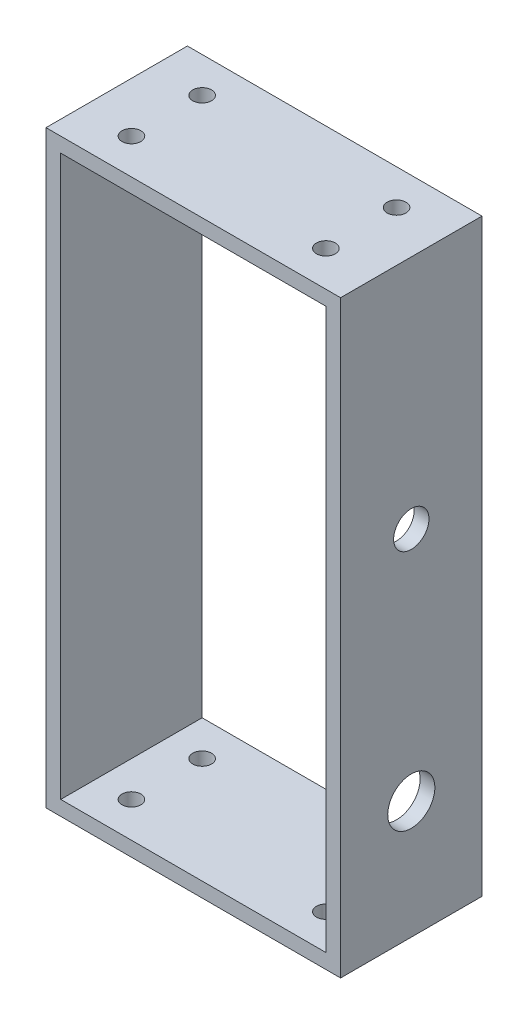
from build123d import *

# Parameters (mm, degrees)
SKETCH_1_W                      = 50
SKETCH_1_H                      = 100
SKETCH_1_W_2                    = 45
SKETCH_1_H_2                    = 95
EXTRUDE_1_DEPTH                 = 24
CUT_EXTRUDE_2_DEPTH             = 106.834776893
CUT_EXTRUDE_2_DEPTH_BACK        = 106.834776893
SKETCH_3_R                      = 1.6
CUT_EXTRUDE_3_REACH             = 76.673
SKETCH_4_R                      = 3
SKETCH_4_R_2                    = 4
CUT_EXTRUDE_3_DIRECTION_2_DEPTH = 75.67261881


with BuildPart() as part:
    # ｽｹｯﾁ1 → ﾎﾞｽ - 押し出し1 (new body)
    with BuildSketch(Plane.XY):
        Rectangle(SKETCH_1_W, SKETCH_1_H)
        Rectangle(SKETCH_1_W_2, SKETCH_1_H_2, mode=Mode.SUBTRACT)
    extrude(amount=EXTRUDE_1_DEPTH)

    # ｽｹｯﾁ3 → ｶｯﾄ - 押し出し2 (cut, two sides: drawn at the far end of the back side and taken through both)
    with BuildSketch(Plane(origin=(0, 50, 0), x_dir=(1, 0, 0), z_dir=(0, 1, 0)).offset(-CUT_EXTRUDE_2_DEPTH_BACK)):
        with Locations(Location((-16.5, -6, 0), (0, 0, 90))):
            Circle(SKETCH_3_R)
        with Locations(Location((16.5, -6, 0), (0, 0, 90))):
            Circle(SKETCH_3_R)
        with Locations(Location((16.5, -18, 0), (0, 0, 90))):
            Circle(SKETCH_3_R)
        with Locations(Location((-16.5, -18, 0), (0, 0, 90))):
            Circle(SKETCH_3_R)
    extrude(amount=CUT_EXTRUDE_2_DEPTH + CUT_EXTRUDE_2_DEPTH_BACK, mode=Mode.SUBTRACT)

    # ｽｹｯﾁ4 → ｶｯﾄ - 押し出し3 (cut, up to next)
    with BuildSketch(Plane(origin=(25, 0, 0), x_dir=(0, 0, -1), z_dir=(1, 0, 0)), mode=Mode.PRIVATE) as cut_extrude_3_sk1:
        with Locations(Location((-12, 10, 0), (0, 0, 270))):
            Circle(SKETCH_4_R)
    cut_extrude_3_tool1 = extrude(cut_extrude_3_sk1.sketch, amount=-CUT_EXTRUDE_3_REACH, mode=Mode.PRIVATE) & part.part
    # ｽｹｯﾁ4 → ｶｯﾄ - 押し出し3 (cut, up to next)
    with BuildSketch(Plane(origin=(25, 0, 0), x_dir=(0, 0, -1), z_dir=(1, 0, 0)), mode=Mode.PRIVATE) as cut_extrude_3_sk2:
        with Locations(Location((-12, -30, 0), (0, 0, 270))):
            Circle(SKETCH_4_R_2)
    cut_extrude_3_tool2 = extrude(cut_extrude_3_sk2.sketch, amount=-CUT_EXTRUDE_3_REACH, mode=Mode.PRIVATE) & part.part
    add(cut_extrude_3_tool1.solids().sort_by_distance((25, 10, 12))[0], mode=Mode.SUBTRACT)
    add(cut_extrude_3_tool2.solids().sort_by_distance((25, -30, 12))[0], mode=Mode.SUBTRACT)

    # ｽｹｯﾁ4 → ｶｯﾄ - 押し出し3 direction 2 (cut)
    with BuildSketch(Plane(origin=(25, 0, 0), x_dir=(0, 0, -1), z_dir=(1, 0, 0))):
        with Locations(Location((-12, 10, 0), (0, 0, 270))):
            Circle(SKETCH_4_R)
        with Locations(Location((-12, -30, 0), (0, 0, 270))):
            Circle(SKETCH_4_R_2)
    extrude(amount=CUT_EXTRUDE_3_DIRECTION_2_DEPTH, mode=Mode.SUBTRACT)


solid = part.part
